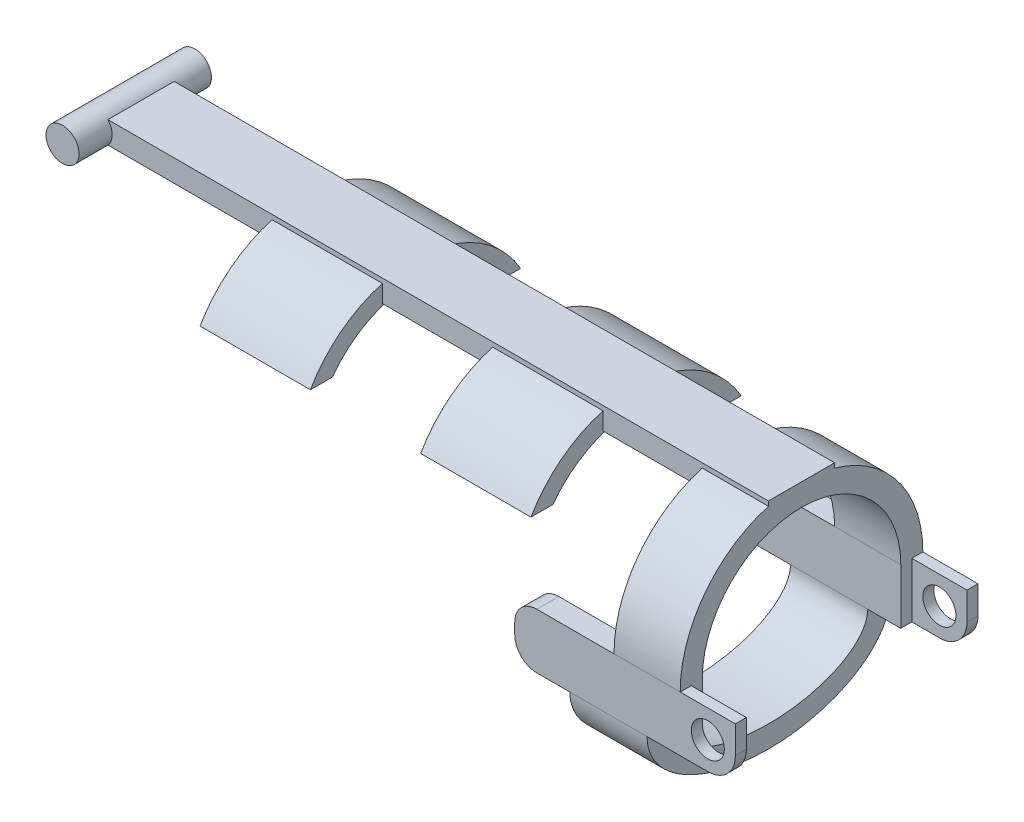
from build123d import *

# Parameters (mm, degrees)
SKETCH1_W                = 2
SKETCH1_H                = 5
BOSS_EXTRUDE1_DEPTH      = 15
BOSS_EXTRUDE1_2_DEPTH    = 15
SKETCH2_W                = 1
SKETCH2_H                = 5
BOSS_EXTRUDE2_DEPTH      = 5
CUT_EXTRUDE1_DEPTH       = 30.107559156
CUT_EXTRUDE1_DEPTH_BACK  = 30.107559156
SKETCH3_R                = 1.5
SWEEP1_START             = 9
SWEEP1_DEPTH             = 6
BOSS_EXTRUDE3_DEPTH      = 12
CUT_EXTRUDE2_DEPTH       = 5
FILLET1_R                = 2
BOSS_EXTRUDE6_START      = -6
SKETCH7_W                = 6
SKETCH7_H                = 2
BOSS_EXTRUDE6_DEPTH      = 61
BOSS_EXTRUDE7_DEPTH      = 3
BOSS_EXTRUDE7_DEPTH_BACK = 9
SKETCH8_R                = 1.5
FILLET2_R                = 2.5
BOSS_EXTRUDE10_DEPTH     = 10
LPATTERN1_COUNT          = 2
LPATTERN1_PITCH          = 20


# Read off the part's stored shape, not the designer's step: Sweep1
with BuildPart() as part:
    # Sketch1 → Boss-Extrude1 (new body)
    with BuildSketch(Plane(origin=(0, 0, 0), x_dir=(0, 0, -1), z_dir=(1, 0, 0))):
        with Locations((-10, 0)):
            Rectangle(SKETCH1_W, SKETCH1_H)
    extrude(amount=BOSS_EXTRUDE1_DEPTH)



with BuildPart() as body_2:
    # Sketch1 → Boss-Extrude1 2 (new body)
    with BuildSketch(Plane(origin=(0, 0, 0), x_dir=(0, 0, -1), z_dir=(1, 0, 0))):
        with Locations((10, 0)):
            Rectangle(SKETCH1_W, SKETCH1_H)
    extrude(amount=BOSS_EXTRUDE1_2_DEPTH)


with BuildPart() as part_1:
    add(part.part)

    add(body_2.part)  # Boss-Extrude2 merges body 2
    # Sketch2 → Boss-Extrude2 (add)
    with BuildSketch(Plane(origin=(15, 0, 0), x_dir=(0, 0, -1), z_dir=(1, 0, 0))):
        with Locations((10.5, 0)):
            Rectangle(SKETCH2_W, SKETCH2_H)
        with Locations((-10.5, 0)):
            Rectangle(SKETCH2_W, SKETCH2_H)
    extrude(amount=BOSS_EXTRUDE2_DEPTH)

    # Sketch3 → Cut-Extrude1 (cut, two sides: drawn at the far end of the back side and taken through both)
    with BuildSketch(Plane.XY.offset(-10).offset(-CUT_EXTRUDE1_DEPTH_BACK)):
        with Locations((17.5, 0)):
            Circle(SKETCH3_R)
    extrude(amount=CUT_EXTRUDE1_DEPTH + CUT_EXTRUDE1_DEPTH_BACK, mode=Mode.SUBTRACT)

    # Sweep1 outline → Sweep1 (add)
    with BuildSketch(Plane.YZ.offset(SWEEP1_START)):
        with BuildLine():
            ThreePointArc((2.5, -11), (13.5, 0), (2.5, 11))
            Line((2.5, 11), (2.5, 9))
            ThreePointArc((2.5, 9), (11.5, 0), (2.5, -9))
            Line((2.5, -9), (2.5, -11))
        make_face()
    extrude(amount=SWEEP1_DEPTH)

    # Sketch5 → Boss-Extrude3 (add)
    with BuildSketch(Plane(origin=(0, 0, 0), x_dir=(0, 0, -1), z_dir=(1, 0, 0))):
        with BuildLine():
            Line((-9, -2.5), (-11, -2.5))
            add(Edge.make_bspline(
                [(-11, -2.5), (-11, -8.980170496), (0, -8.980170496)],
                knots=[3.141592654, 3.141592654, 3.141592654, 4.71238898, 4.71238898, 4.71238898], degree=2, weights=[1, 0.707106781, 1]))
            Line((0, -8.980170496), (0, -7.009343108))
            add(Edge.make_bspline(
                [(-9, -2.5), (-9, -7.009343108), (0, -7.009343108)],
                knots=[3.141592654, 3.141592654, 3.141592654, 4.71238898, 4.71238898, 4.71238898], degree=2, weights=[1, 0.707106781, 1]))
        make_face()
    boss_extrude3 = extrude(amount=BOSS_EXTRUDE3_DEPTH)

    # Sketch6 → Cut-Extrude2 (cut)
    with BuildSketch(Plane.ZY):
        with BuildLine():
            Line((11, -2.5), (9, -2.5))
            add(Edge.make_bspline(
                [(0, -7.009343108), (9, -7.009343108), (9, -2.5)],
                knots=[4.71238898, 4.71238898, 4.71238898, 6.283185307, 6.283185307, 6.283185307], degree=2, weights=[1, 0.707106781, 1]))
            Line((0, -7.009343108), (0, -8.980170496))
            add(Edge.make_bspline(
                [(0, -8.980170496), (11, -8.980170496), (11, -2.5)],
                knots=[4.71238898, 4.71238898, 4.71238898, 6.283185307, 6.283185307, 6.283185307], degree=2, weights=[1, 0.707106781, 1]))
        make_face()
    cut_extrude2 = extrude(amount=-CUT_EXTRUDE2_DEPTH, mode=Mode.SUBTRACT)

    # Mirror2: Boss-Extrude3, Cut-Extrude2 across plane
    add(boss_extrude3.mirror(Plane(origin=(12, -8.980170496, 0), x_dir=(1, 0, 0), z_dir=(0, 0, 1))))
    add(cut_extrude2.mirror(Plane(origin=(12, -8.980170496, 0), x_dir=(1, 0, 0), z_dir=(0, 0, 1))), mode=Mode.SUBTRACT)

    # Fillet1
    fillet1_edges = [part_1.edges().sort_by_distance(p)[0] for p in [
        (0, -2.5, -10),
        (0, 2.5, -10),
        (0, 2.5, 10),
        (0, -2.5, 10),
    ]]
    fillet(fillet1_edges, radius=FILLET1_R)

    # Sketch7 → Boss-Extrude6 (add)
    with BuildSketch(Plane.ZY.offset(-9).offset(BOSS_EXTRUDE6_START)):
        with Locations((0, 12.5)):
            Rectangle(SKETCH7_W, SKETCH7_H)
    extrude(amount=BOSS_EXTRUDE6_DEPTH)

    # Sketch8 → Boss-Extrude7 (add, two sides: drawn at the far end of the back side and taken through both)
    with BuildSketch(Plane.XY.offset(3).offset(-BOSS_EXTRUDE7_DEPTH_BACK)):
        with Locations((-46, 12.5)):
            Circle(SKETCH8_R)
    extrude(amount=BOSS_EXTRUDE7_DEPTH + BOSS_EXTRUDE7_DEPTH_BACK)

    # Fillet2
    fillet2_edges = [part_1.edges().sort_by_distance(p)[0] for p in [
        (20, -2.5, -10.5),
        (20, -2.5, 10.5),
    ]]
    fillet(fillet2_edges, radius=FILLET2_R)

    # 3DSketch3 → Boss-Extrude10 (add)
    with BuildSketch(Plane(origin=(-10, 7.995255445, 9.529017137), x_dir=(0, 0, -1), z_dir=(1, 0, 0))):
        with BuildLine():
            Line((0, 0), (2, 0))
            ThreePointArc((2, 0), (9.529017137, 3.825899604), (17.058034273, 0))
            Line((17.058034273, 0), (19.058034273, 0))
            ThreePointArc((19.058034273, 0), (15.031388903, 4.029654263), (9.529017137, 5.504744555))
            ThreePointArc((9.529017137, 5.504744555), (4.026645371, 4.029654263), (0, 0))
        make_face()
    boss_extrude10 = extrude(amount=BOSS_EXTRUDE10_DEPTH)

    # LPattern1: Boss-Extrude10 ×2
    with Locations(*[(-i * LPATTERN1_PITCH, 0, 0) for i in range(1, LPATTERN1_COUNT)]):
        add(boss_extrude10)


solid = part_1.part
